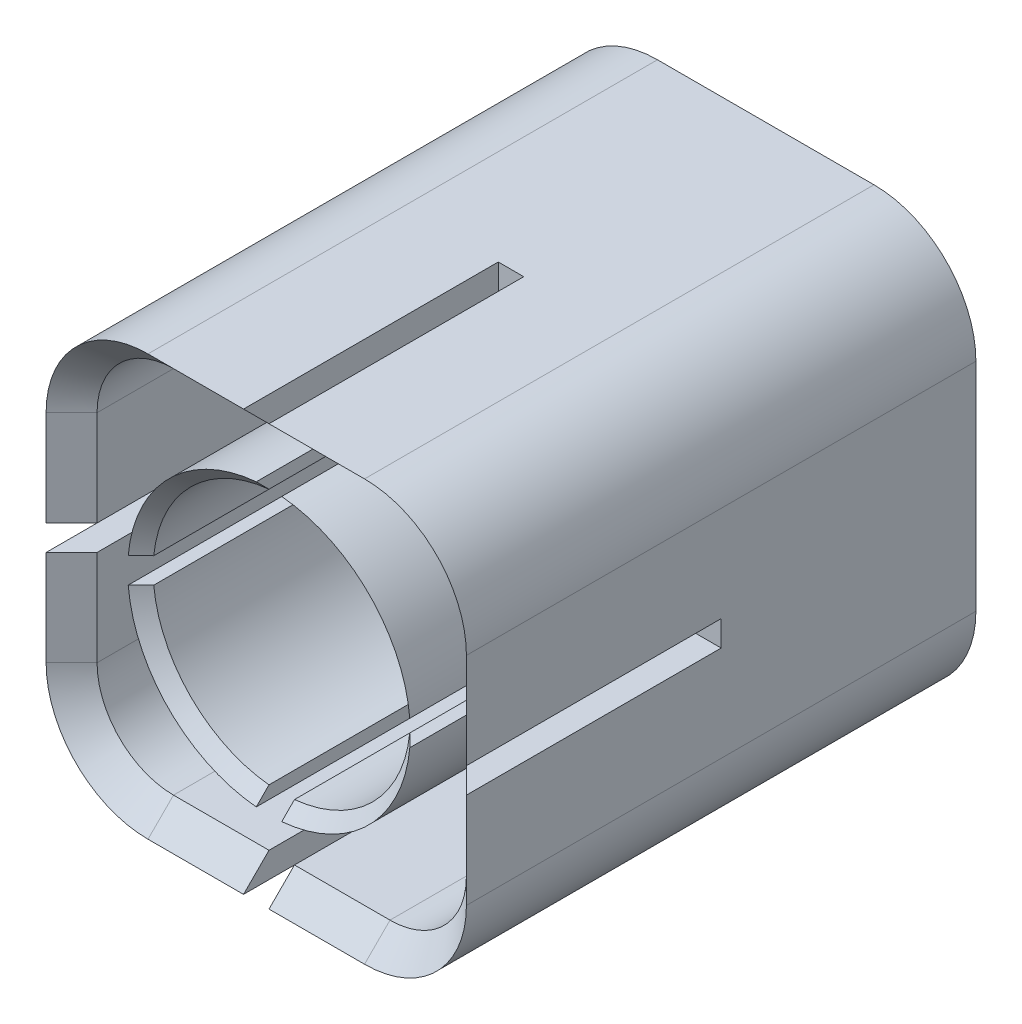
from build123d import *

# Parameters (mm, degrees)
BOSS_EXTRUDE1_DEPTH = 10
SHELL7_T            = -1
SKETCH4_R           = 5.55
SKETCH4_R_2         = 5.05
BOSS_EXTRUDE2_DEPTH = 19
CHAMFER2_SIZE       = 1
CHAMFER4_SIZE       = 1
SKETCH10_W          = 1
SKETCH10_H          = 10
SKETCH10_W_2        = 10
SKETCH10_H_2        = 1
CUT_EXTRUDE2_DEPTH  = 10


# Some blends are built 0.0001 mm under size
with BuildPart() as part:
    # Sketch2 → Boss-Extrude1 (new, symmetric)
    with BuildSketch(Plane.XY):
        with BuildLine():
            Line((4.25, -8.25), (-4.25, -8.25))
            ThreePointArc((-4.25, -8.25), (-7.078427125, -7.078427125), (-8.25, -4.25))
            Line((-8.25, -4.25), (-8.25, 4.25))
            ThreePointArc((-8.25, 4.25), (-7.078427125, 7.078427125), (-4.25, 8.25))
            Line((-4.25, 8.25), (4.25, 8.25))
            ThreePointArc((4.25, 8.25), (7.078427125, 7.078427125), (8.25, 4.25))
            Line((8.25, 4.25), (8.25, -4.25))
            ThreePointArc((8.25, -4.25), (7.078427125, -7.078427125), (4.25, -8.25))
        make_face()
    extrude(amount=BOSS_EXTRUDE1_DEPTH, both=True)

    # Shell7
    shell7_openings = [part.faces().sort_by_distance(p)[0] for p in [
        (0, 0, 10),
    ]]
    offset(amount=SHELL7_T, openings=shell7_openings, kind=Kind.INTERSECTION)

    # Chamfer4
    chamfer4_edges = [part.edges().sort_by_distance(p)[0] for p in [
        (6.371320344, 6.371320344, 10),
        (-7.25, 0, 10),
        (0, -7.25, 10),
        (6.371320344, -6.371320344, 10),
        (0, 7.25, 10),
        (-6.371320344, 6.371320344, 10),
        (-6.371320344, -6.371320344, 10),
        (7.25, 0, 10),
    ]]
    chamfer(chamfer4_edges, length=CHAMFER4_SIZE - 0.0001)  # a hair under: the kernel refuses the full size


with BuildPart() as body_2:
    # Sketch4 → Boss-Extrude2 (new body)
    with BuildSketch(Plane.XY.offset(-9)):
        with Locations(Location((0, 0, 0), (0, 0, 180))):
            Circle(SKETCH4_R)
        with Locations(Location((0, 0, 0), (0, 0, 180))):
            Circle(SKETCH4_R_2, mode=Mode.SUBTRACT)
    extrude(amount=BOSS_EXTRUDE2_DEPTH)

    # Chamfer2
    # the kernel refuses this chamfer: 1 mm, written as the material it takes off along each edge
    with BuildSketch(Plane(origin=(0, 0, 10), x_dir=(-1, 0, 0), z_dir=(0, 1, 0))) as chamfer2_piece_1:
        Polygon((5.05, -CHAMFER2_SIZE), (5.05 + CHAMFER2_SIZE, 0), (5.05, 0), align=None)
    revolve(axis=Axis((0, 0, 10), (0, 0, 1)), mode=Mode.SUBTRACT)


with BuildPart() as cut_extrude2_tool:
    # Sketch10 → Cut-Extrude2 (new body)
    with BuildSketch(Plane.XY):
        with Locations((0, 8)):
            Rectangle(SKETCH10_W, SKETCH10_H)
        with Locations((8, 0)):
            Rectangle(SKETCH10_W_2, SKETCH10_H_2)
        with Locations((0, -8)):
            Rectangle(SKETCH10_W, SKETCH10_H)
        with Locations((-8, 0)):
            Rectangle(SKETCH10_W_2, SKETCH10_H_2)
    extrude(amount=CUT_EXTRUDE2_DEPTH)


with BuildPart() as part_1:
    add(part.part)

    # Cut-Extrude2: cut by cut_extrude2_tool
    add(cut_extrude2_tool.part, mode=Mode.SUBTRACT)


with BuildPart() as body_2_1:
    add(body_2.part)

    # Cut-Extrude2: cut by cut_extrude2_tool
    add(cut_extrude2_tool.part, mode=Mode.SUBTRACT)


solid = Compound([part_1.part, body_2_1.part])
